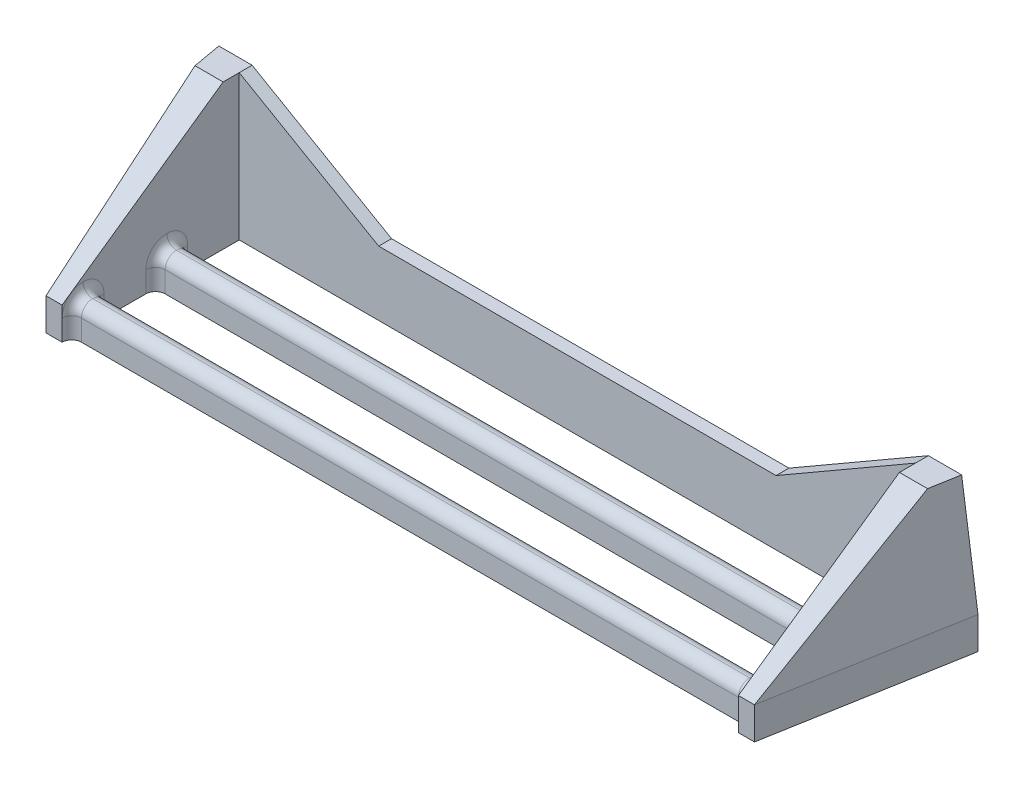
from build123d import *
from OCP.BRepFilletAPI import BRepFilletAPI_MakeChamfer

# Parameters (mm, degrees)
AUFSATZ_LINEAR_AUSTRAGEN1_DEPTH = 45
FASE1_SIZE                      = 35
FASE1_SIZE2                     = 50
FASE2_SIZE                      = 35
FASE2_SIZE2                     = 5
SCHNITT_LINEAR_AUSTRAGEN2_DEPTH = 140.810416962
SKIZZE4_W                       = 210
SKIZZE4_H                       = 7
AUFSATZ_LINEAR_AUSTRAGEN2_DEPTH = 10
VERRUNDUNG2_R                   = 3.5
VERRUNDUNG3_R                   = 3


with BuildPart() as part:
    # Skizze1 → Aufsatz-Linear austragen1 (new body)
    with BuildSketch(Plane(origin=(0, 0, 0), x_dir=(1, 0, 0), z_dir=(0, 1, 0))):
        Polygon((-105, -55), (-105, 0), (105, 0), (105, -55), (110, -55), (120.403291862, 4), (-120.403291862, 4), (-110, -55), align=None)
    extrude(amount=AUFSATZ_LINEAR_AUSTRAGEN1_DEPTH)

    # Fase1: one chamfer whose edges measure the first distance from different faces: ONE call of the kernel's chamfer builder (chamfer() names one face for all edges)
    fase1_edges_1 = [part.edges().sort_by_distance(p)[0] for p in [
        (107.5, 45, 55),
    ]]
    fase1_side_1 = [part.faces().sort_by_distance(p)[0] for p in [
        (107.5, 22.5, 55),
    ]]
    fase1_edges_2 = [part.edges().sort_by_distance(p)[0] for p in [
        (-107.5, 45, 55),
    ]]
    fase1_side_2 = [part.faces().sort_by_distance(p)[0] for p in [
        (-107.5, 22.5, 55),
    ]]
    fase1 = BRepFilletAPI_MakeChamfer(part.part.solid().wrapped)
    for e in fase1_edges_1:
        fase1.Add(FASE1_SIZE, FASE1_SIZE2, e.wrapped, fase1_side_1[0].wrapped)  # the first distance lies on this face
    for e in fase1_edges_2:
        fase1.Add(FASE1_SIZE, FASE1_SIZE2, e.wrapped, fase1_side_2[0].wrapped)  # the first distance lies on this face
    add(Compound.cast(fase1.Shape()), mode=Mode.REPLACE)

    # Fase2: one chamfer whose edges measure the first distance from different faces: ONE call of the kernel's chamfer builder (chamfer() names one face for all edges)
    fase2_edges_1 = [part.edges().sort_by_distance(p)[0] for p in [
        (-119.609820449, 45, 0.5),
    ]]
    fase2_side_1 = [part.faces().sort_by_distance(p)[0] for p in [
        (-116.314008321, 17.174625468, 19.191479401),
    ]]
    fase2_edges_2 = [part.edges().sort_by_distance(p)[0] for p in [
        (119.609820449, 45, 0.5),
    ]]
    fase2_side_2 = [part.faces().sort_by_distance(p)[0] for p in [
        (116.314008321, 17.174625468, 19.191479401),
    ]]
    fase2 = BRepFilletAPI_MakeChamfer(part.part.solid().wrapped)
    for e in fase2_edges_1:
        fase2.Add(FASE2_SIZE, FASE2_SIZE2, e.wrapped, fase2_side_1[0].wrapped)  # the first distance lies on this face
    for e in fase2_edges_2:
        fase2.Add(FASE2_SIZE, FASE2_SIZE2, e.wrapped, fase2_side_2[0].wrapped)  # the first distance lies on this face
    add(Compound.cast(fase2.Shape()), mode=Mode.REPLACE)

    # Skizze2 → Schnitt-Linear austragen2 (cut, through all)
    with BuildSketch(Plane.XY):
        Polygon((-105, 45), (-61.698729811, 20), (61.698729811, 20), (105, 45), align=None)
    extrude(amount=-SCHNITT_LINEAR_AUSTRAGEN2_DEPTH, mode=Mode.SUBTRACT)

    # Skizze4 → Aufsatz-Linear austragen2 (add)
    with BuildSketch(Plane(origin=(0, 0, 0), x_dir=(1, 0, 0), z_dir=(0, 1, 0))):
        with Locations((0, -48.5)):
            Rectangle(SKIZZE4_W, SKIZZE4_H)
        with Locations((0, -22.5)):
            Rectangle(SKIZZE4_W, SKIZZE4_H)
    extrude(amount=AUFSATZ_LINEAR_AUSTRAGEN2_DEPTH)

    # Verrundung2
    verrundung2_edges = [part.edges().sort_by_distance(p)[0] for p in [
        (0, 10, 52),
        (0, 10, 45),
        (0, 10, 19),
        (0, 10, 26),
    ]]
    fillet(verrundung2_edges, radius=VERRUNDUNG2_R - 0.0001)  # a hair under: the kernel refuses the full size

    # Verrundung3
    verrundung3_edges = [part.edges().sort_by_distance(p)[0] for p in [
        (-105, 8.974903023, 24.974903023),
        (105, 3.25005, 52),
        (-105, 3.25005, 52),
        (-105, 3.25005, 45),
        (105, 3.25005, 45),
        (-105, 3.25005, 19),
        (105, 3.25005, 19),
        (105, 3.25005, 26),
        (-105, 3.25005, 26),
        (105, 8.974903023, 50.974903023),
        (-105, 8.974903023, 50.974903023),
        (-105, 8.974903023, 46.025096977),
        (105, 8.974903023, 46.025096977),
        (-105, 8.974903023, 20.025096977),
        (105, 8.974903023, 20.025096977),
        (105, 8.974903023, 24.974903023),
    ]]
    fillet(verrundung3_edges, radius=VERRUNDUNG3_R - 0.0001)  # a hair under: the kernel refuses the full size


solid = part.part
